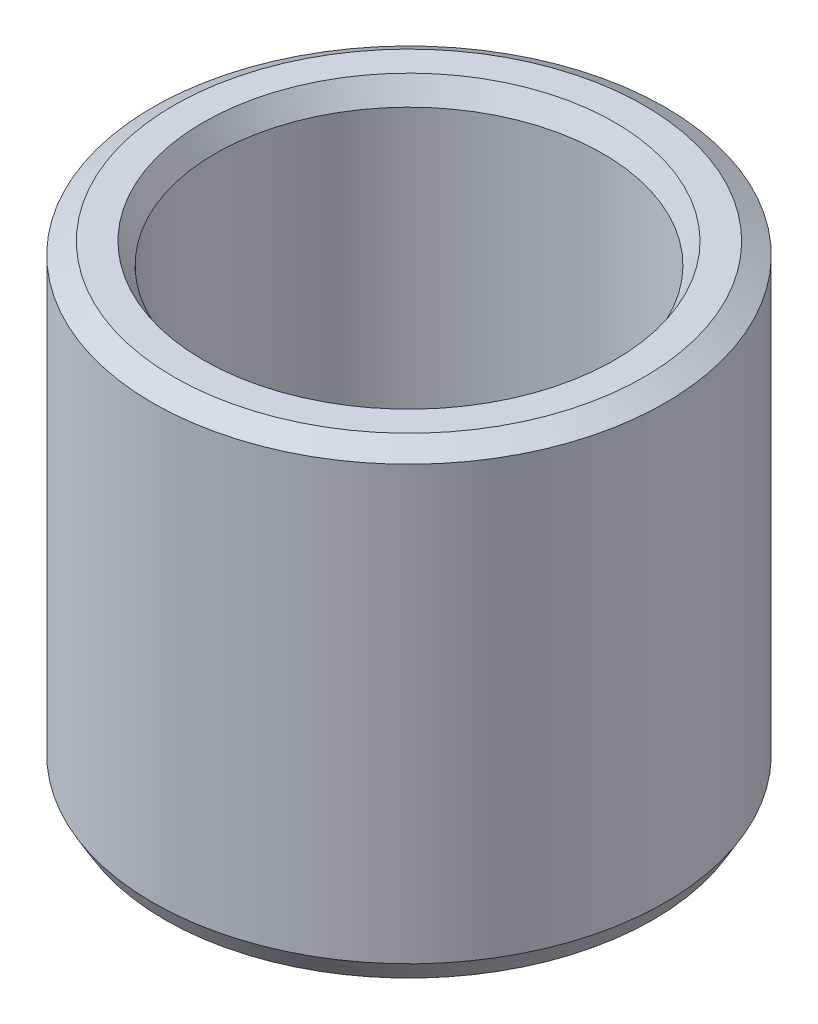
from build123d import *
from OCP.BRepFilletAPI import BRepFilletAPI_MakeChamfer

# Parameters (mm, degrees)
SKETCH1_R           = 22.5
BOSS_EXTRUDE1_DEPTH = 40.898474017
SKETCH2_R           = 17.015456844
CUT_EXTRUDE1_DEPTH  = 52.818772437
CHAMFER1_SIZE       = 1.061221257
CHAMFER1_SIZE2      = 1.838089135


with BuildPart() as part:
    # Sketch1 → Boss-Extrude1 (new body)
    with BuildSketch(Plane(origin=(0, 0, 0), x_dir=(1, 0, 0), z_dir=(0, 1, 0))):
        Circle(SKETCH1_R)
    extrude(amount=BOSS_EXTRUDE1_DEPTH)

    # Sketch2 → Cut-Extrude1 (cut, through all)
    with BuildSketch(Plane(origin=(0, 0, 0), x_dir=(1, 0, 0), z_dir=(0, 1, 0))):
        Circle(SKETCH2_R)
    extrude(amount=CUT_EXTRUDE1_DEPTH, mode=Mode.SUBTRACT)

    # Chamfer1: one chamfer whose edges measure the first distance from different faces: ONE call of the kernel's chamfer builder (chamfer() names one face for all edges)
    chamfer1_edges_1 = [part.edges().sort_by_distance(p)[0] for p in [
        (-17.015456844, 40.898474017, 0),
    ]]
    chamfer1_side_1 = [part.faces().sort_by_distance(p)[0] for p in [
        (-21.863603897, 40.898474017, 0),
    ]]
    chamfer1_edges_2 = [part.edges().sort_by_distance(p)[0] for p in [
        (-17.015456844, 0, 0),
    ]]
    chamfer1_side_2 = [part.faces().sort_by_distance(p)[0] for p in [
        (-17.015456844, 20.449237008, 0),
    ]]
    chamfer1_edges_3 = [part.edges().sort_by_distance(p)[0] for p in [
        (-22.5, 0, 0),
    ]]
    chamfer1_side_3 = [part.faces().sort_by_distance(p)[0] for p in [
        (-21.863603897, 0, 0),
    ]]
    chamfer1_edges_4 = [part.edges().sort_by_distance(p)[0] for p in [
        (-22.5, 40.898474017, 0),
    ]]
    chamfer1_side_4 = [part.faces().sort_by_distance(p)[0] for p in [
        (-22.5, 20.449237008, 0),
    ]]
    chamfer1 = BRepFilletAPI_MakeChamfer(part.part.solid().wrapped)
    for e in chamfer1_edges_1:
        chamfer1.Add(CHAMFER1_SIZE, CHAMFER1_SIZE2, e.wrapped, chamfer1_side_1[0].wrapped)  # the first distance lies on this face
    for e in chamfer1_edges_2:
        chamfer1.Add(CHAMFER1_SIZE, CHAMFER1_SIZE2, e.wrapped, chamfer1_side_2[0].wrapped)  # the first distance lies on this face
    for e in chamfer1_edges_3:
        chamfer1.Add(CHAMFER1_SIZE, CHAMFER1_SIZE2, e.wrapped, chamfer1_side_3[0].wrapped)  # the first distance lies on this face
    for e in chamfer1_edges_4:
        chamfer1.Add(CHAMFER1_SIZE, CHAMFER1_SIZE2, e.wrapped, chamfer1_side_4[0].wrapped)  # the first distance lies on this face
    add(Compound.cast(chamfer1.Shape()), mode=Mode.REPLACE)


solid = part.part
